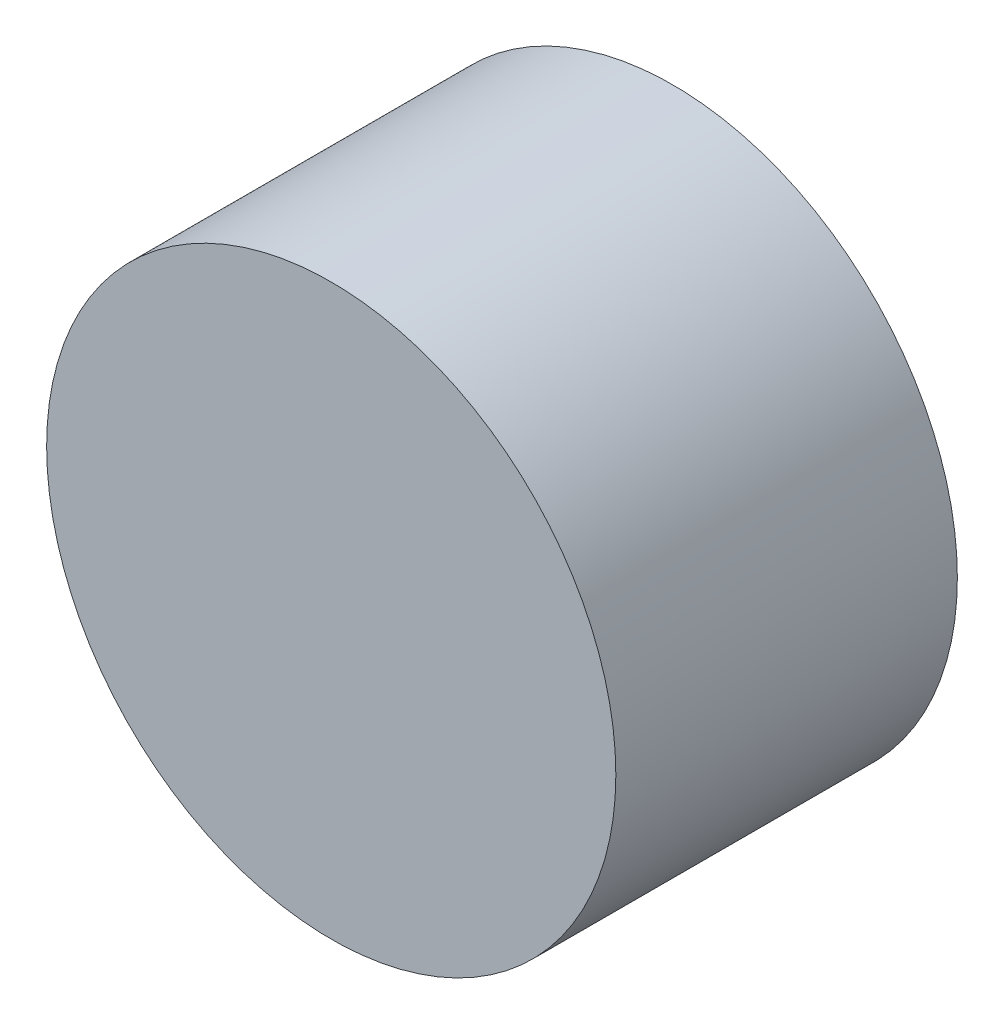
from build123d import *

# Parameters (mm, degrees)
SKETCH1_R           = 22.5
BOSS_EXTRUDE1_DEPTH = 13.5


with BuildPart() as part:
    # Sketch1 → Boss-Extrude1 (new, symmetric)
    with BuildSketch(Plane.XY):
        Circle(SKETCH1_R)
    extrude(amount=BOSS_EXTRUDE1_DEPTH, both=True)


solid = part.part
